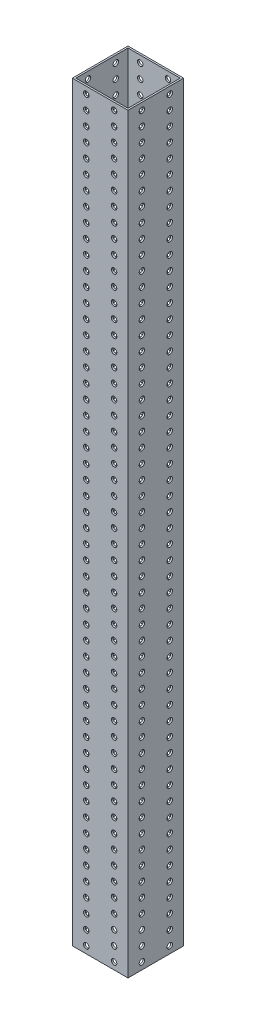
from build123d import *

# Parameters (mm, degrees)
SKETCH1_W           = 50.8
SKETCH1_H           = 50.8
SKETCH1_W_2         = 47.625
SKETCH1_H_2         = 47.625
BOSS_EXTRUDE1_DEPTH = 685.8
SKETCH2_R           = 2.4892
CUT_EXTRUDE1_DEPTH  = 689.147832955
SKETCH4_R           = 2.4892
CUT_EXTRUDE2_DEPTH  = 689.147832955


with BuildPart() as part:
    # Sketch1 → Boss-Extrude1 (new body)
    with BuildSketch(Plane(origin=(0, 0, 0), x_dir=(1, 0, 0), z_dir=(0, 1, 0))):
        Rectangle(SKETCH1_W, SKETCH1_H)
        Rectangle(SKETCH1_W_2, SKETCH1_H_2, mode=Mode.SUBTRACT)
    extrude(amount=BOSS_EXTRUDE1_DEPTH)

    # Sketch2 → Cut-Extrude1 (cut, through all)
    with BuildSketch(Plane.XY.offset(25.4)):
        with Locations((-12.7, 679.45)):
            Circle(SKETCH2_R)
        with Locations((-12.7, 666.75)):
            Circle(SKETCH2_R)
        with Locations((-12.7, 654.05)):
            Circle(SKETCH2_R)
        with Locations((-12.7, 641.35)):
            Circle(SKETCH2_R)
        with Locations((-12.7, 628.65)):
            Circle(SKETCH2_R)
        with Locations((-12.7, 615.95)):
            Circle(SKETCH2_R)
        with Locations((-12.7, 603.25)):
            Circle(SKETCH2_R)
        with Locations((-12.7, 590.55)):
            Circle(SKETCH2_R)
        with Locations((-12.7, 577.85)):
            Circle(SKETCH2_R)
        with Locations((-12.7, 565.15)):
            Circle(SKETCH2_R)
        with Locations((-12.7, 552.45)):
            Circle(SKETCH2_R)
        with Locations((-12.7, 539.75)):
            Circle(SKETCH2_R)
        with Locations((-12.7, 527.05)):
            Circle(SKETCH2_R)
        with Locations((-12.7, 514.35)):
            Circle(SKETCH2_R)
        with Locations((-12.7, 501.65)):
            Circle(SKETCH2_R)
        with Locations((-12.7, 488.95)):
            Circle(SKETCH2_R)
        with Locations((-12.7, 476.25)):
            Circle(SKETCH2_R)
        with Locations((-12.7, 463.55)):
            Circle(SKETCH2_R)
        with Locations((-12.7, 450.85)):
            Circle(SKETCH2_R)
        with Locations((-12.7, 438.15)):
            Circle(SKETCH2_R)
        with Locations((-12.7, 425.45)):
            Circle(SKETCH2_R)
        with Locations((-12.7, 412.75)):
            Circle(SKETCH2_R)
        with Locations((-12.7, 400.05)):
            Circle(SKETCH2_R)
        with Locations((-12.7, 387.35)):
            Circle(SKETCH2_R)
        with Locations((-12.7, 374.65)):
            Circle(SKETCH2_R)
        with Locations((-12.7, 361.95)):
            Circle(SKETCH2_R)
        with Locations((-12.7, 349.25)):
            Circle(SKETCH2_R)
        with Locations((-12.7, 336.55)):
            Circle(SKETCH2_R)
        with Locations((-12.7, 323.85)):
            Circle(SKETCH2_R)
        with Locations((-12.7, 311.15)):
            Circle(SKETCH2_R)
        with Locations((-12.7, 298.45)):
            Circle(SKETCH2_R)
        with Locations((-12.7, 285.75)):
            Circle(SKETCH2_R)
        with Locations((-12.7, 273.05)):
            Circle(SKETCH2_R)
        with Locations((-12.7, 260.35)):
            Circle(SKETCH2_R)
        with Locations((-12.7, 247.65)):
            Circle(SKETCH2_R)
        with Locations((-12.7, 234.95)):
            Circle(SKETCH2_R)
        with Locations((-12.7, 222.25)):
            Circle(SKETCH2_R)
        with Locations((-12.7, 209.55)):
            Circle(SKETCH2_R)
        with Locations((-12.7, 196.85)):
            Circle(SKETCH2_R)
        with Locations((-12.7, 184.15)):
            Circle(SKETCH2_R)
        with Locations((-12.7, 171.45)):
            Circle(SKETCH2_R)
        with Locations((-12.7, 158.75)):
            Circle(SKETCH2_R)
        with Locations((-12.7, 146.05)):
            Circle(SKETCH2_R)
        with Locations((-12.7, 133.35)):
            Circle(SKETCH2_R)
        with Locations((-12.7, 120.65)):
            Circle(SKETCH2_R)
        with Locations((-12.7, 107.95)):
            Circle(SKETCH2_R)
        with Locations((-12.7, 95.25)):
            Circle(SKETCH2_R)
        with Locations((-12.7, 82.55)):
            Circle(SKETCH2_R)
        with Locations((-12.7, 69.85)):
            Circle(SKETCH2_R)
        with Locations((-12.7, 57.15)):
            Circle(SKETCH2_R)
        with Locations((-12.7, 44.45)):
            Circle(SKETCH2_R)
        with Locations((-12.7, 31.75)):
            Circle(SKETCH2_R)
        with Locations((-12.7, 19.05)):
            Circle(SKETCH2_R)
        with Locations((-12.7, 6.35)):
            Circle(SKETCH2_R)
        with Locations((12.7, 6.35)):
            Circle(SKETCH2_R)
        with Locations((12.7, 19.05)):
            Circle(SKETCH2_R)
        with Locations((12.7, 31.75)):
            Circle(SKETCH2_R)
        with Locations((12.7, 44.45)):
            Circle(SKETCH2_R)
        with Locations((12.7, 57.15)):
            Circle(SKETCH2_R)
        with Locations((12.7, 69.85)):
            Circle(SKETCH2_R)
        with Locations((12.7, 82.55)):
            Circle(SKETCH2_R)
        with Locations((12.7, 95.25)):
            Circle(SKETCH2_R)
        with Locations((12.7, 107.95)):
            Circle(SKETCH2_R)
        with Locations((12.7, 120.65)):
            Circle(SKETCH2_R)
        with Locations((12.7, 133.35)):
            Circle(SKETCH2_R)
        with Locations((12.7, 146.05)):
            Circle(SKETCH2_R)
        with Locations((12.7, 158.75)):
            Circle(SKETCH2_R)
        with Locations((12.7, 171.45)):
            Circle(SKETCH2_R)
        with Locations((12.7, 184.15)):
            Circle(SKETCH2_R)
        with Locations((12.7, 196.85)):
            Circle(SKETCH2_R)
        with Locations((12.7, 209.55)):
            Circle(SKETCH2_R)
        with Locations((12.7, 222.25)):
            Circle(SKETCH2_R)
        with Locations((12.7, 234.95)):
            Circle(SKETCH2_R)
        with Locations((12.7, 247.65)):
            Circle(SKETCH2_R)
        with Locations((12.7, 260.35)):
            Circle(SKETCH2_R)
        with Locations((12.7, 273.05)):
            Circle(SKETCH2_R)
        with Locations((12.7, 285.75)):
            Circle(SKETCH2_R)
        with Locations((12.7, 298.45)):
            Circle(SKETCH2_R)
        with Locations((12.7, 311.15)):
            Circle(SKETCH2_R)
        with Locations((12.7, 323.85)):
            Circle(SKETCH2_R)
        with Locations((12.7, 336.55)):
            Circle(SKETCH2_R)
        with Locations((12.7, 374.65)):
            Circle(SKETCH2_R)
        with Locations((12.7, 361.95)):
            Circle(SKETCH2_R)
        with Locations((12.7, 349.25)):
            Circle(SKETCH2_R)
        with Locations((12.7, 387.35)):
            Circle(SKETCH2_R)
        with Locations((12.7, 400.05)):
            Circle(SKETCH2_R)
        with Locations((12.7, 412.75)):
            Circle(SKETCH2_R)
        with Locations((12.7, 425.45)):
            Circle(SKETCH2_R)
        with Locations((12.7, 438.15)):
            Circle(SKETCH2_R)
        with Locations((12.7, 450.85)):
            Circle(SKETCH2_R)
        with Locations((12.7, 463.55)):
            Circle(SKETCH2_R)
        with Locations((12.7, 476.25)):
            Circle(SKETCH2_R)
        with Locations((12.7, 488.95)):
            Circle(SKETCH2_R)
        with Locations((12.7, 501.65)):
            Circle(SKETCH2_R)
        with Locations((12.7, 514.35)):
            Circle(SKETCH2_R)
        with Locations((12.7, 527.05)):
            Circle(SKETCH2_R)
        with Locations((12.7, 539.75)):
            Circle(SKETCH2_R)
        with Locations((12.7, 552.45)):
            Circle(SKETCH2_R)
        with Locations((12.7, 565.15)):
            Circle(SKETCH2_R)
        with Locations((12.7, 577.85)):
            Circle(SKETCH2_R)
        with Locations((12.7, 590.55)):
            Circle(SKETCH2_R)
        with Locations((12.7, 603.25)):
            Circle(SKETCH2_R)
        with Locations((12.7, 615.95)):
            Circle(SKETCH2_R)
        with Locations((12.7, 628.65)):
            Circle(SKETCH2_R)
        with Locations((12.7, 641.35)):
            Circle(SKETCH2_R)
        with Locations((12.7, 654.05)):
            Circle(SKETCH2_R)
        with Locations((12.7, 666.75)):
            Circle(SKETCH2_R)
        with Locations((12.7, 679.45)):
            Circle(SKETCH2_R)
    extrude(amount=-CUT_EXTRUDE1_DEPTH, mode=Mode.SUBTRACT)

    # Sketch4 → Cut-Extrude2 (cut, through all)
    with BuildSketch(Plane(origin=(25.4, 0, 0), x_dir=(0, 0, -1), z_dir=(1, 0, 0))):
        with Locations((-12.7, 679.45)):
            Circle(SKETCH4_R)
        with Locations((-12.7, 666.75)):
            Circle(SKETCH4_R)
        with Locations((-12.7, 654.05)):
            Circle(SKETCH4_R)
        with Locations((-12.7, 641.35)):
            Circle(SKETCH4_R)
        with Locations((-12.7, 628.65)):
            Circle(SKETCH4_R)
        with Locations((-12.7, 615.95)):
            Circle(SKETCH4_R)
        with Locations((-12.7, 603.25)):
            Circle(SKETCH4_R)
        with Locations((-12.7, 590.55)):
            Circle(SKETCH4_R)
        with Locations((-12.7, 577.85)):
            Circle(SKETCH4_R)
        with Locations((-12.7, 565.15)):
            Circle(SKETCH4_R)
        with Locations((-12.7, 552.45)):
            Circle(SKETCH4_R)
        with Locations((-12.7, 539.75)):
            Circle(SKETCH4_R)
        with Locations((-12.7, 527.05)):
            Circle(SKETCH4_R)
        with Locations((-12.7, 514.35)):
            Circle(SKETCH4_R)
        with Locations((-12.7, 501.65)):
            Circle(SKETCH4_R)
        with Locations((-12.7, 488.95)):
            Circle(SKETCH4_R)
        with Locations((-12.7, 476.25)):
            Circle(SKETCH4_R)
        with Locations((-12.7, 463.55)):
            Circle(SKETCH4_R)
        with Locations((-12.7, 450.85)):
            Circle(SKETCH4_R)
        with Locations((-12.7, 438.15)):
            Circle(SKETCH4_R)
        with Locations((-12.7, 425.45)):
            Circle(SKETCH4_R)
        with Locations((-12.7, 412.75)):
            Circle(SKETCH4_R)
        with Locations((-12.7, 400.05)):
            Circle(SKETCH4_R)
        with Locations((-12.7, 387.35)):
            Circle(SKETCH4_R)
        with Locations((-12.7, 374.65)):
            Circle(SKETCH4_R)
        with Locations((-12.7, 361.95)):
            Circle(SKETCH4_R)
        with Locations((-12.7, 349.25)):
            Circle(SKETCH4_R)
        with Locations((-12.7, 336.55)):
            Circle(SKETCH4_R)
        with Locations((-12.7, 323.85)):
            Circle(SKETCH4_R)
        with Locations((-12.7, 311.15)):
            Circle(SKETCH4_R)
        with Locations((-12.7, 298.45)):
            Circle(SKETCH4_R)
        with Locations((-12.7, 285.75)):
            Circle(SKETCH4_R)
        with Locations((-12.7, 273.05)):
            Circle(SKETCH4_R)
        with Locations((-12.7, 260.35)):
            Circle(SKETCH4_R)
        with Locations((-12.7, 247.65)):
            Circle(SKETCH4_R)
        with Locations((-12.7, 234.95)):
            Circle(SKETCH4_R)
        with Locations((-12.7, 222.25)):
            Circle(SKETCH4_R)
        with Locations((-12.7, 209.55)):
            Circle(SKETCH4_R)
        with Locations((-12.7, 196.85)):
            Circle(SKETCH4_R)
        with Locations((-12.7, 184.15)):
            Circle(SKETCH4_R)
        with Locations((-12.7, 171.45)):
            Circle(SKETCH4_R)
        with Locations((-12.7, 158.75)):
            Circle(SKETCH4_R)
        with Locations((-12.7, 146.05)):
            Circle(SKETCH4_R)
        with Locations((-12.7, 133.35)):
            Circle(SKETCH4_R)
        with Locations((-12.7, 120.65)):
            Circle(SKETCH4_R)
        with Locations((-12.7, 107.95)):
            Circle(SKETCH4_R)
        with Locations((-12.7, 95.25)):
            Circle(SKETCH4_R)
        with Locations((-12.7, 82.55)):
            Circle(SKETCH4_R)
        with Locations((-12.7, 69.85)):
            Circle(SKETCH4_R)
        with Locations((-12.7, 57.15)):
            Circle(SKETCH4_R)
        with Locations((-12.7, 44.45)):
            Circle(SKETCH4_R)
        with Locations((-12.7, 31.75)):
            Circle(SKETCH4_R)
        with Locations((-12.7, 19.05)):
            Circle(SKETCH4_R)
        with Locations((-12.7, 6.35)):
            Circle(SKETCH4_R)
        with Locations((12.7, 273.05)):
            Circle(SKETCH4_R)
        with Locations((12.7, 285.75)):
            Circle(SKETCH4_R)
        with Locations((12.7, 298.45)):
            Circle(SKETCH4_R)
        with Locations((12.7, 311.15)):
            Circle(SKETCH4_R)
        with Locations((12.7, 323.85)):
            Circle(SKETCH4_R)
        with Locations((12.7, 336.55)):
            Circle(SKETCH4_R)
        with Locations((12.7, 349.25)):
            Circle(SKETCH4_R)
        with Locations((12.7, 361.95)):
            Circle(SKETCH4_R)
        with Locations((12.7, 374.65)):
            Circle(SKETCH4_R)
        with Locations((12.7, 387.35)):
            Circle(SKETCH4_R)
        with Locations((12.7, 400.05)):
            Circle(SKETCH4_R)
        with Locations((12.7, 412.75)):
            Circle(SKETCH4_R)
        with Locations((12.7, 425.45)):
            Circle(SKETCH4_R)
        with Locations((12.7, 438.15)):
            Circle(SKETCH4_R)
        with Locations((12.7, 450.85)):
            Circle(SKETCH4_R)
        with Locations((12.7, 463.55)):
            Circle(SKETCH4_R)
        with Locations((12.7, 476.25)):
            Circle(SKETCH4_R)
        with Locations((12.7, 488.95)):
            Circle(SKETCH4_R)
        with Locations((12.7, 501.65)):
            Circle(SKETCH4_R)
        with Locations((12.7, 514.35)):
            Circle(SKETCH4_R)
        with Locations((12.7, 527.05)):
            Circle(SKETCH4_R)
        with Locations((12.7, 539.75)):
            Circle(SKETCH4_R)
        with Locations((12.7, 552.45)):
            Circle(SKETCH4_R)
        with Locations((12.7, 565.15)):
            Circle(SKETCH4_R)
        with Locations((12.7, 577.85)):
            Circle(SKETCH4_R)
        with Locations((12.7, 590.55)):
            Circle(SKETCH4_R)
        with Locations((12.7, 603.25)):
            Circle(SKETCH4_R)
        with Locations((12.7, 615.95)):
            Circle(SKETCH4_R)
        with Locations((12.7, 628.65)):
            Circle(SKETCH4_R)
        with Locations((12.7, 641.35)):
            Circle(SKETCH4_R)
        with Locations((12.7, 654.05)):
            Circle(SKETCH4_R)
        with Locations((12.7, 666.75)):
            Circle(SKETCH4_R)
        with Locations((12.7, 19.05)):
            Circle(SKETCH4_R)
        with Locations((12.7, 31.75)):
            Circle(SKETCH4_R)
        with Locations((12.7, 44.45)):
            Circle(SKETCH4_R)
        with Locations((12.7, 57.15)):
            Circle(SKETCH4_R)
        with Locations((12.7, 69.85)):
            Circle(SKETCH4_R)
        with Locations((12.7, 82.55)):
            Circle(SKETCH4_R)
        with Locations((12.7, 95.25)):
            Circle(SKETCH4_R)
        with Locations((12.7, 107.95)):
            Circle(SKETCH4_R)
        with Locations((12.7, 120.65)):
            Circle(SKETCH4_R)
        with Locations((12.7, 133.35)):
            Circle(SKETCH4_R)
        with Locations((12.7, 146.05)):
            Circle(SKETCH4_R)
        with Locations((12.7, 158.75)):
            Circle(SKETCH4_R)
        with Locations((12.7, 171.45)):
            Circle(SKETCH4_R)
        with Locations((12.7, 184.15)):
            Circle(SKETCH4_R)
        with Locations((12.7, 196.85)):
            Circle(SKETCH4_R)
        with Locations((12.7, 209.55)):
            Circle(SKETCH4_R)
        with Locations((12.7, 222.25)):
            Circle(SKETCH4_R)
        with Locations((12.7, 234.95)):
            Circle(SKETCH4_R)
        with Locations((12.7, 247.65)):
            Circle(SKETCH4_R)
        with Locations((12.7, 260.35)):
            Circle(SKETCH4_R)
        with Locations((12.7, 6.35)):
            Circle(SKETCH4_R)
        with Locations((12.7, 679.45)):
            Circle(SKETCH4_R)
    extrude(amount=-CUT_EXTRUDE2_DEPTH, mode=Mode.SUBTRACT)


solid = part.part
